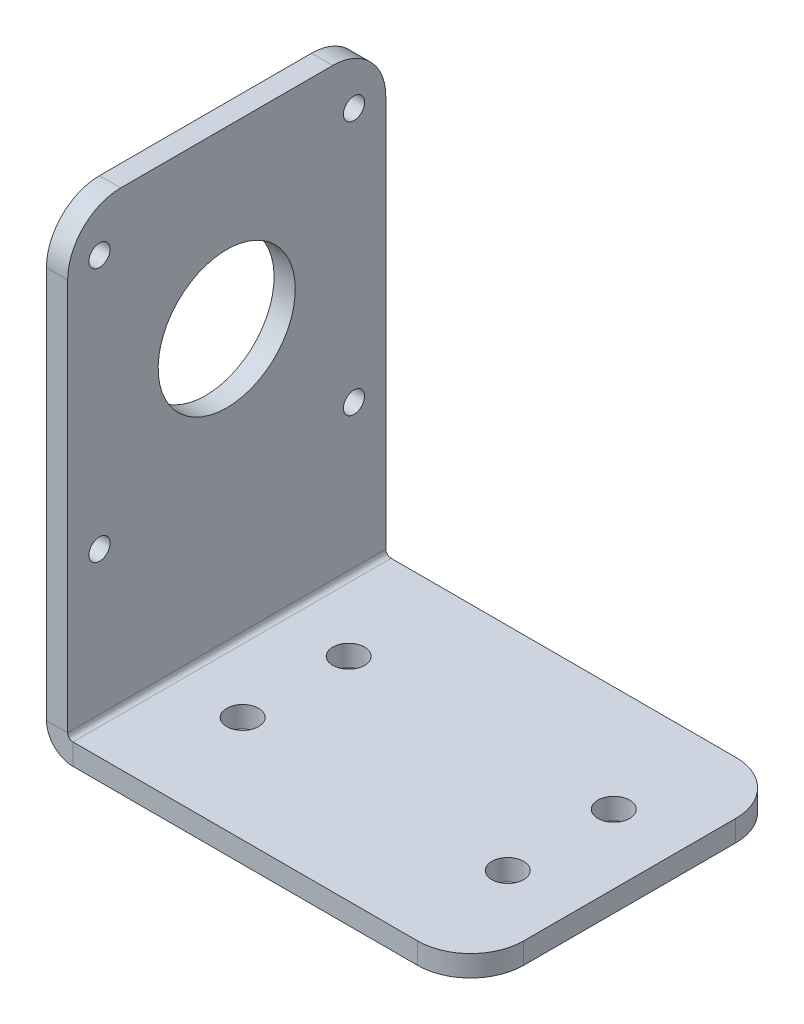
from build123d import *

# Parameters (mm, degrees)
CROQUIS1_W             = 37.5
CROQUIS1_H             = 30
BRIDA_BASE1_DEPTH      = 2
BRIDA_DE_ARISTA1_DEPTH = 30
CROQUIS9_R             = 1.5
CORTAR_EXTRUIR1_DEPTH  = 10
REDONDEO1_R            = 5
CROQUIS10_R            = 6.466120371
CROQUIS10_R_2          = 1
CORTAR_EXTRUIR2_DEPTH  = 2
REDONDEO2_R            = 5


# Sheet-metal steps are written as plain solids
with BuildPart() as part:
    # Croquis1 → Brida base1 (new body)
    with BuildSketch(Plane(origin=(0, 0, 0), x_dir=(1, 0, 0), z_dir=(0, 1, 0))):
        Rectangle(CROQUIS1_W, CROQUIS1_H)
    extrude(amount=-BRIDA_BASE1_DEPTH)

    # Brida de arista1 section (across the edge) → Brida de arista1 (add)
    with BuildSketch(Plane(origin=(-19.25, 0, -15), x_dir=(1, 0, 0), z_dir=(0, 0, 1))):
        with BuildLine():
            Line((-2, 0.5), (-2, 42.5))
            Line((-2, 42.5), (0, 42.5))
            Line((0, 42.5), (0, 0.5))
            ThreePointArc((0, 0.5), (0.146446609, 0.146446609), (0.5, 0))
            Line((0.5, 0), (0.5, -2))
            ThreePointArc((0.5, -2), (-1.267766953, -1.267766953), (-2, 0.5))
        make_face()
    extrude(amount=BRIDA_DE_ARISTA1_DEPTH)

    # Croquis9 → Cortar-Extruir1 (cut)
    with BuildSketch(Plane.XZ.offset(2)):
        with Locations(Location((-12.75, 5, 0), (0, 0, 270))):
            Circle(CROQUIS9_R)
        with Locations(Location((12.25, 5, 0), (0, 0, 270))):
            Circle(CROQUIS9_R)
        with Locations(Location((12.25, -5, 0), (0, 0, 270))):
            Circle(CROQUIS9_R)
        with Locations(Location((-12.75, -5, 0), (0, 0, 270))):
            Circle(CROQUIS9_R)
    extrude(amount=-CORTAR_EXTRUIR1_DEPTH, mode=Mode.SUBTRACT)

    # Redondeo1
    redondeo1_edges = [part.edges().sort_by_distance(p)[0] for p in [
        (18.75, -1, 15),
        (18.75, -1, -15),
    ]]
    fillet(redondeo1_edges, radius=REDONDEO1_R)

    # Croquis10 → Cortar-Extruir2 (cut)
    with BuildSketch(Plane.ZY.offset(21.25)):
        with Locations(Location((0, 26, 0), (0, 0, 270))):
            Circle(CROQUIS10_R)
        with Locations(Location((-12, 38, 0), (0, 0, 270))):
            Circle(CROQUIS10_R_2)
        with Locations(Location((12, 38, 0), (0, 0, 270))):
            Circle(CROQUIS10_R_2)
        with Locations(Location((12, 14, 0), (0, 0, 270))):
            Circle(CROQUIS10_R_2)
        with Locations(Location((-12, 14, 0), (0, 0, 270))):
            Circle(CROQUIS10_R_2)
    extrude(amount=-CORTAR_EXTRUIR2_DEPTH, mode=Mode.SUBTRACT)

    # Redondeo2
    redondeo2_edges = [part.edges().sort_by_distance(p)[0] for p in [
        (-20.25, 42.5, -15),
        (-20.25, 42.5, 15),
    ]]
    fillet(redondeo2_edges, radius=REDONDEO2_R)


solid = part.part
